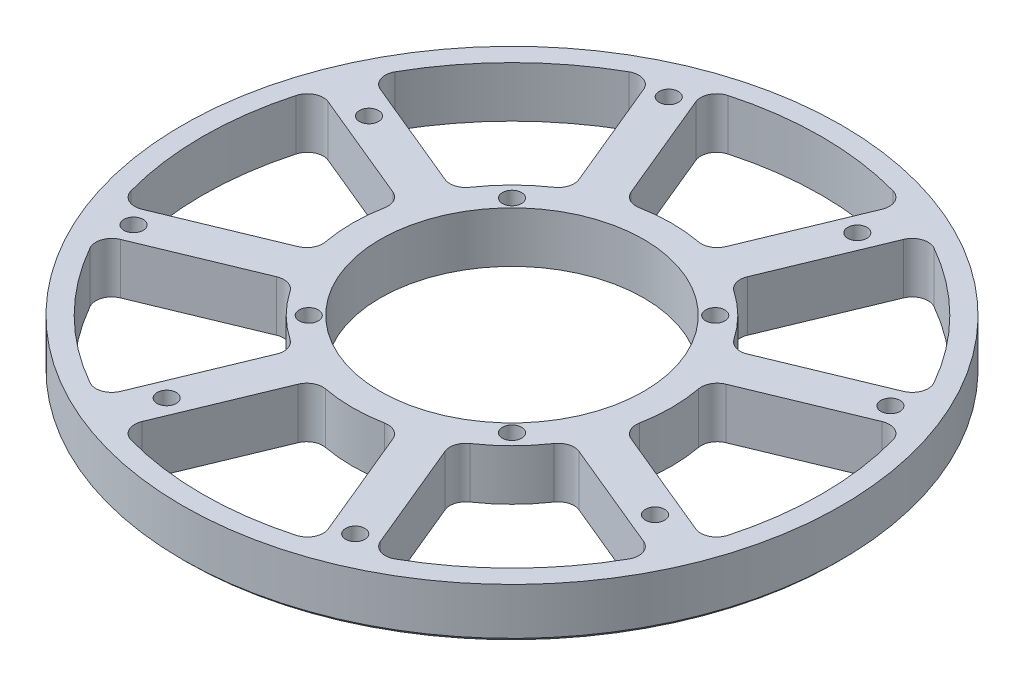
from build123d import *

# Parameters (mm, degrees)
SKETCH2_W                   = 82.55
SKETCH2_H                   = 12.7
F_12_0_189_DIAMETER_HOLE1_D = 4.8006
CIRPATTERN3_COUNT           = 4
CUT_EXTRUDE1_DEPTH          = 118.432086757
FILLET1_R                   = 4
CIRPATTERN4_COUNT           = 8
FILLET1_OF_CIRPATTERN4_R    = 4
CHAMFER2_SIZE               = 1
SKETCH9_R                   = 33
CUT_EXTRUDE2_DEPTH          = 118.432086757


with BuildPart() as part:
    # Sketch2 → Revolve1 (revolve)
    with BuildSketch(Plane(origin=(0, 0, 0), x_dir=(0, 0, -1), z_dir=(1, 0, 0))):
        with Locations((-41.275, 6.35)):
            Rectangle(SKETCH2_W, SKETCH2_H)
    revolve(axis=Axis((0, -0.635, 0), (0, 1, 0)))

    # #12 (0.189) Diameter Hole1 (through all)
    with Locations(Plane(origin=(0, 12.7, 0), x_dir=(1, 0, 0), z_dir=(0, 1, 0))):
        with Locations((-27.763683018, 67.027460084), (-61.160825052, 25.333643223), (-25.455844123, 25.455844123)):
            f_12_0_189_diameter_hole1 = Hole(F_12_0_189_DIAMETER_HOLE1_D / 2)

    # CirPattern3: #12 (0.189) Diameter Hole1 ×4 about axis
    cirpattern3_axis = Axis((0, -0.635, 0), (0, 1, 0))
    for i in range(1, CIRPATTERN3_COUNT):
        add(f_12_0_189_diameter_hole1.rotate(cirpattern3_axis, i * 360 / CIRPATTERN3_COUNT), mode=Mode.SUBTRACT)

    # Sketch8 → Cut-Extrude1 (cut, through all)
    with BuildSketch(Plane(origin=(0, 12.7, 0), x_dir=(1, 0, 0), z_dir=(0, 1, 0))):
        with BuildLine():
            Line((-10.567880231, 38.578749428), (-24.995954941, 73.411203073))
            ThreePointArc((-24.995954941, 73.411203073), (0, 77.55), (24.995954941, 73.411203073))
            Line((24.995954941, 73.411203073), (10.567880231, 38.578749428))
            ThreePointArc((10.567880231, 38.578749428), (0, 40), (-10.567880231, 38.578749428))
        make_face()
    cut_extrude1 = extrude(amount=-CUT_EXTRUDE1_DEPTH, mode=Mode.SUBTRACT)

    # Fillet1
    fillet1_edges = [part.edges().sort_by_distance(p)[0] for p in [
        (10.567880231, 6.35, -38.578749428),
        (24.995954941, 6.35, -73.411203073),
        (-10.567880231, 6.35, -38.578749428),
        (-24.995954941, 6.35, -73.411203073),
    ]]
    fillet(fillet1_edges, radius=FILLET1_R)

    # CirPattern4: Cut-Extrude1 ×8 about axis
    cirpattern4_axis = Axis((0, -0.635, 0), (0, 1, 0))
    for i in range(1, CIRPATTERN4_COUNT):
        add(cut_extrude1.rotate(cirpattern4_axis, i * 360 / CIRPATTERN4_COUNT), mode=Mode.SUBTRACT)

    # Fillet1 of CirPattern4
    fillet1_of_cirpattern4_edges = [part.edges().sort_by_distance(p)[0] for p in [
        (-19.806675556, 6.35, -34.751915104),
        (-34.234750266, 6.35, -69.584368749),
        (-34.751915104, 6.35, -19.806675556),
        (-69.584368749, 6.35, -34.234750266),
        (-38.578749428, 6.35, -10.567880231),
        (-73.411203073, 6.35, -24.995954941),
        (-38.578749428, 6.35, 10.567880231),
        (-73.411203073, 6.35, 24.995954941),
        (-34.751915104, 6.35, 19.806675556),
        (-69.584368749, 6.35, 34.234750266),
        (-19.806675556, 6.35, 34.751915104),
        (-34.234750266, 6.35, 69.584368749),
        (-10.567880231, 6.35, 38.578749428),
        (-24.995954941, 6.35, 73.411203073),
        (10.567880231, 6.35, 38.578749428),
        (24.995954941, 6.35, 73.411203073),
        (19.806675556, 6.35, 34.751915104),
        (34.234750266, 6.35, 69.584368749),
        (34.751915104, 6.35, 19.806675556),
        (69.584368749, 6.35, 34.234750266),
        (38.578749428, 6.35, 10.567880231),
        (73.411203073, 6.35, 24.995954941),
        (38.578749428, 6.35, -10.567880231),
        (73.411203073, 6.35, -24.995954941),
        (34.751915104, 6.35, -19.806675556),
        (69.584368749, 6.35, -34.234750266),
        (19.806675556, 6.35, -34.751915104),
        (34.234750266, 6.35, -69.584368749),
    ]]
    fillet(fillet1_of_cirpattern4_edges, radius=FILLET1_OF_CIRPATTERN4_R)

    # Chamfer2
    chamfer2_edges = [part.edges().sort_by_distance(p)[0] for p in [
        (0, 0, -82.55),
    ]]
    chamfer(chamfer2_edges, length=CHAMFER2_SIZE)

    # Sketch9 → Cut-Extrude2 (cut, through all)
    with BuildSketch(Plane(origin=(0, 12.7, 0), x_dir=(1, 0, 0), z_dir=(0, 1, 0))):
        Circle(SKETCH9_R)
    extrude(amount=-CUT_EXTRUDE2_DEPTH, mode=Mode.SUBTRACT)


solid = part.part
